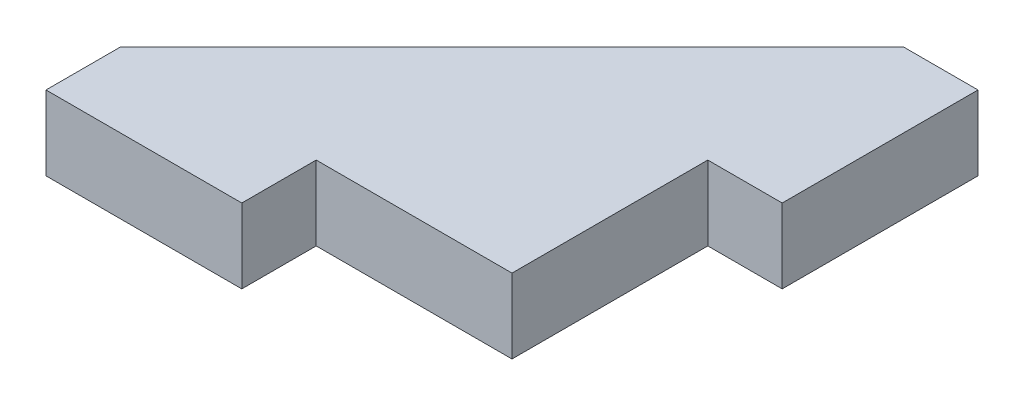
from build123d import *

# Parameters (mm, degrees)
BOSS_EXTRUDE1_DEPTH = 4.826


with BuildPart() as part:
    # Sketch1 → Boss-Extrude1 (new body)
    with BuildSketch(Plane(origin=(0, 0, 0), x_dir=(1, 0, 0), z_dir=(0, 1, 0))):
        Polygon((4.338014563, 11.777885777), (-21.061985437, -13.622114223), (-21.061985437, -18.448114223), (-8.361985437, -18.448114223), (-8.361985437, -13.622114223), (4.338014563, -13.622114223), (4.338014563, -0.922114223), (9.164014563, -0.922114223), (9.164014563, 11.777885777), align=None)
    extrude(amount=BOSS_EXTRUDE1_DEPTH)


solid = part.part
